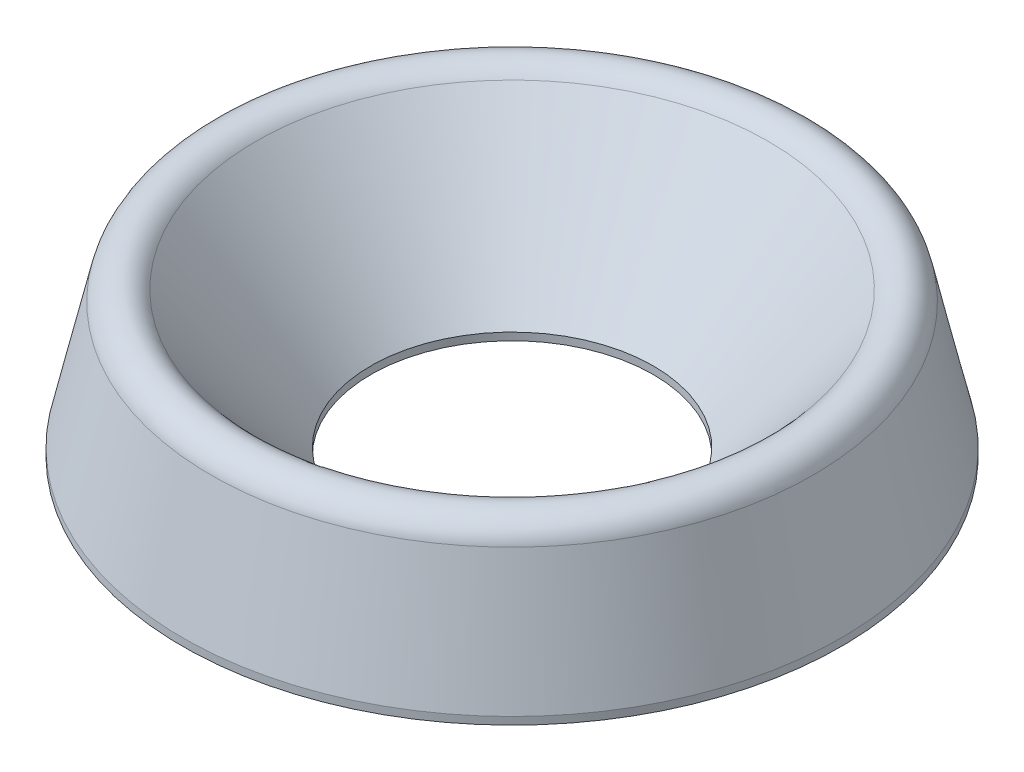
from build123d import *


# Read off the part's stored shape, not the designer's step: Shell2
with BuildPart() as part:
    # Sketch1 → Revolve1 (revolve)
    with BuildSketch(Plane.XY, mode=Mode.PRIVATE) as revolve1_sk:
        with BuildLine():
            Line((-5.55625, 0), (-5.55625, 0.127))
            Line((-5.55625, 0.127), (-5.070967234, 2.25500545))
            ThreePointArc((-5.070967234, 2.25500545), (-4.751339811, 2.57873382), (-4.319197328, 2.43655569))
            Line((-4.319197328, 2.43655569), (-2.38125, 0.127))
            Line((-2.38125, 0.127), (-2.38125, 0))
            Line((-2.38125, 0), (-5.55625, 0))
        make_face()
    revolve(revolve1_sk.sketch.rotate(Axis((0, 0, 0), (0, 1, 0)), 270), axis=Axis((0, 0, 0), (0, 1, 0)))

    # Shell2 outline → Shell2 (revolve, cut)
    with BuildSketch(Plane.XY):
        Polygon((4.459036573, 1.368353826), (3.310851383, 0), (4.7625, 0), (4.7625, 0.03764136), align=None)
    revolve(axis=Axis((0, 0, 0), (0, 1, 0)), mode=Mode.SUBTRACT)


solid = part.part
